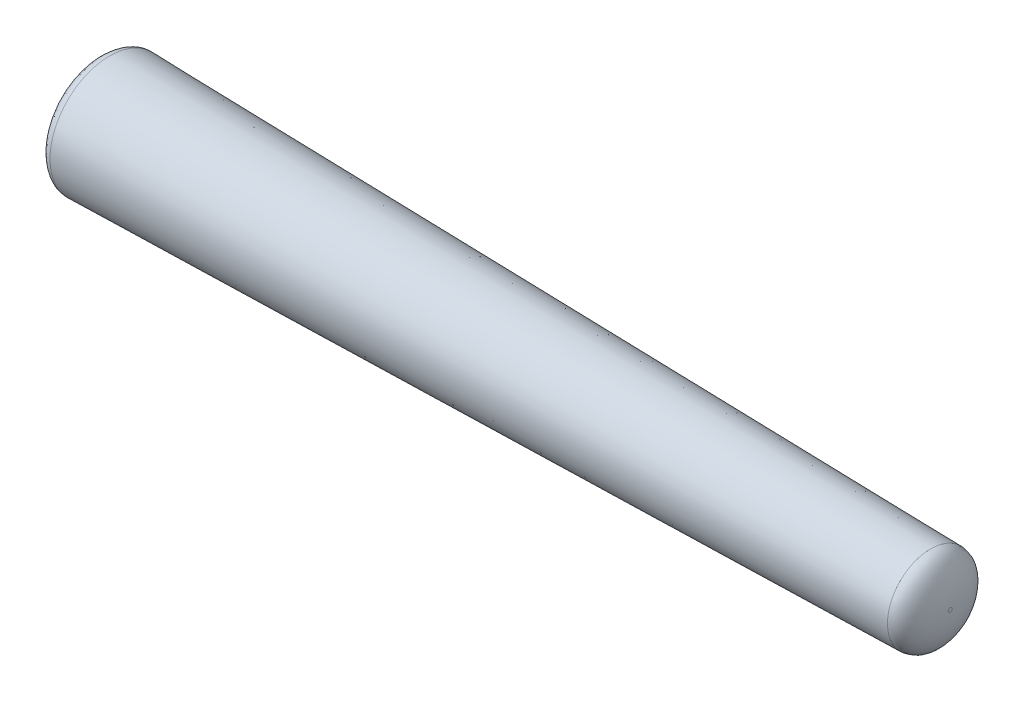
from build123d import *

# Parameters (mm, degrees)
SKETCH2_R                     = 2.5
BOSS_EXTRUDE1_DEPTH           = 21
BOSS_EXTRUDE1_TAPER           = 1.15
BOSS_EXTRUDE1_OTHER_WAY_DEPTH = 21
BOSS_EXTRUDE1_OTHER_WAY_TAPER = -1.15


with BuildPart() as part:
    # Sketch2 → Boss-Extrude1 (new body)
    with BuildSketch(Plane(origin=(0, 0, 0), x_dir=(0, 0, -1), z_dir=(1, 0, 0))):
        Circle(SKETCH2_R)
    extrude(amount=BOSS_EXTRUDE1_DEPTH, taper=BOSS_EXTRUDE1_TAPER)

    # Sketch2 → Boss-Extrude1 other way (add)
    with BuildSketch(Plane(origin=(0, 0, 0), x_dir=(0, 0, -1), z_dir=(1, 0, 0))):
        Circle(SKETCH2_R)
    extrude(amount=-BOSS_EXTRUDE1_OTHER_WAY_DEPTH, taper=BOSS_EXTRUDE1_OTHER_WAY_TAPER)

    # Fillet1
    # an asymmetric fillet: 2.8, 1 mm, written as the material it takes off along each edge
    with BuildSketch(Plane(origin=(-21, 0, 0), x_dir=(0, 0, -1), z_dir=(0, -1, 0))) as fillet1_piece_1:
        with BuildLine():
            Bezier((2.900351568, 1.056195829), (2.921553624, 0), (0.100915548, 0), weights=[1, 0.699975021, 1])
            Line((0.100915548, 0), (2.921553624, 0))
            Line((2.921553624, 0), (2.900351568, 1.056195829))
        make_face()
    revolve(axis=Axis((-21, 0, 0), (1, 0, 0)), mode=Mode.SUBTRACT)

    # Fillet2
    # an asymmetric fillet: 2, 1 mm, written as the material it takes off along each edge
    with BuildSketch(Plane(origin=(21, 0, 0), x_dir=(0, 0, -1), z_dir=(0, 1, 0))) as fillet2_piece_1:
        with BuildLine():
            Bezier((2.097714591, 0.959860122), (2.078446376, 0), (0.098117434, 0), weights=[1, 0.714167326, 1])
            Line((0.098117434, 0), (2.078446376, 0))
            Line((2.078446376, 0), (2.097714591, 0.959860122))
        make_face()
    revolve(axis=Axis((21, 0, 0), (-1, 0, 0)), mode=Mode.SUBTRACT)


solid = part.part
